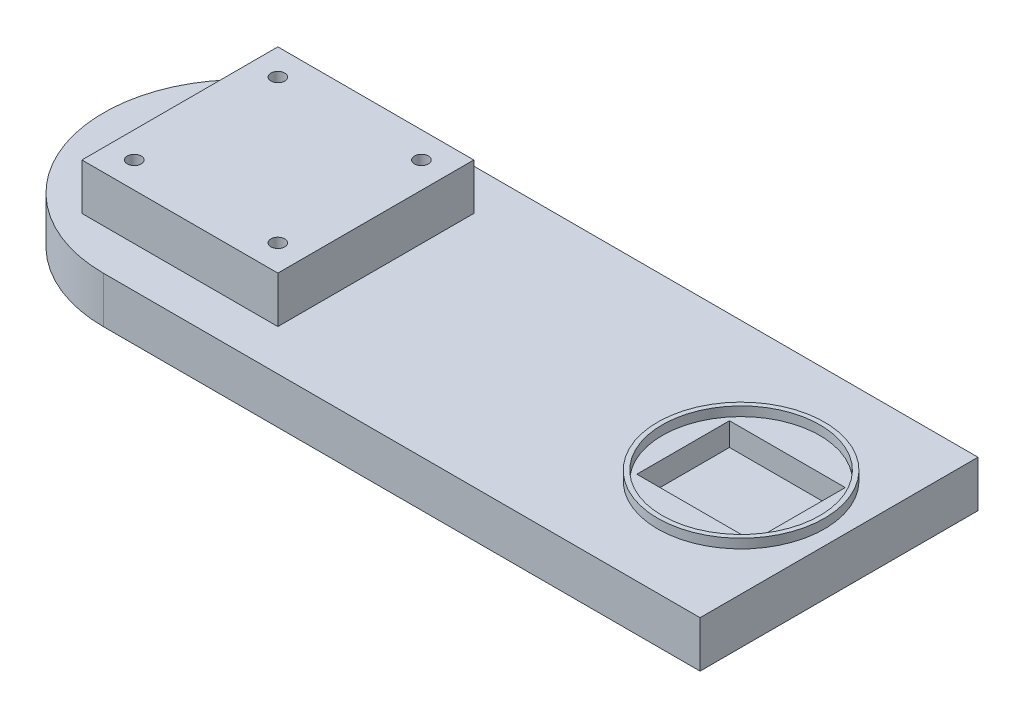
from build123d import *

# Parameters (mm, degrees)
BOSS_EXTRUDE1_DEPTH     = 10
SKETCH3_W               = 25
SKETCH3_H               = 20
CUT_EXTRUDE1_DEPTH      = 5
SKETCH5_R               = 18
SKETCH5_R_2             = 17
BOSS_EXTRUDE2_DEPTH     = 2
SKETCH2_3_W             = 42.3
SKETCH2_3_H             = 42.3
SKETCH2_3_R             = 1.5
BOSS_EXTRUDE3_DEPTH     = 20
CUT_EXTRUDE2_DEPTH      = 127.401433932
CUT_EXTRUDE2_DEPTH_BACK = 127.401433932
SKETCH2_4_R             = 1.5


with BuildPart() as part:
    # Sketch2 → Boss-Extrude1 (new body)
    with BuildSketch(Plane(origin=(0, 0, 0), x_dir=(1, 0, 0), z_dir=(0, 1, 0))):
        with BuildLine():
            ThreePointArc((-7.63782392, 30), (-37.63782392, 0), (-7.63782392, -30))
            Line((-7.63782392, -30), (121.15, -30))
            Line((121.15, -30), (121.15, 30))
            Line((121.15, 30), (-7.63782392, 30))
        make_face()
    extrude(amount=BOSS_EXTRUDE1_DEPTH)

    # Sketch3 → Cut-Extrude1 (cut)
    with BuildSketch(Plane(origin=(0, 10, 0), x_dir=(1, 0, 0), z_dir=(0, 1, 0))):
        with Locations((100, 0)):
            Rectangle(SKETCH3_W, SKETCH3_H)
    extrude(amount=-CUT_EXTRUDE1_DEPTH, mode=Mode.SUBTRACT)

    # Sketch5 → Boss-Extrude2 (add)
    with BuildSketch(Plane(origin=(0, 10, 0), x_dir=(1, 0, 0), z_dir=(0, 1, 0))):
        with Locations((100, 0)):
            Circle(SKETCH5_R)
        with Locations((100, 0)):
            Circle(SKETCH5_R_2, mode=Mode.SUBTRACT)
    extrude(amount=BOSS_EXTRUDE2_DEPTH)

    # Sketch2<3> → Boss-Extrude3 (add)
    with BuildSketch(Plane(origin=(0, 0, 0), x_dir=(1, 0, 0), z_dir=(0, 1, 0))):
        Rectangle(SKETCH2_3_W, SKETCH2_3_H)
        with Locations((-15.5, -15.5)):
            Circle(SKETCH2_3_R, mode=Mode.SUBTRACT)
        with Locations((15.5, -15.5)):
            Circle(SKETCH2_3_R, mode=Mode.SUBTRACT)
        with Locations((-15.5, 15.5)):
            Circle(SKETCH2_3_R, mode=Mode.SUBTRACT)
        with Locations((15.5, 15.5)):
            Circle(SKETCH2_3_R, mode=Mode.SUBTRACT)
    extrude(amount=BOSS_EXTRUDE3_DEPTH)

    # Sketch2<4> → Cut-Extrude2 (cut, two sides: drawn at the far end of the back side and taken through both)
    with BuildSketch(Plane(origin=(0, 0, 0), x_dir=(1, 0, 0), z_dir=(0, 1, 0)).offset(-CUT_EXTRUDE2_DEPTH_BACK)):
        with Locations((-15.5, 15.5)):
            Circle(SKETCH2_4_R)
        with Locations((15.5, 15.5)):
            Circle(SKETCH2_4_R)
        with Locations((15.5, -15.5)):
            Circle(SKETCH2_4_R)
        with Locations((-15.5, -15.5)):
            Circle(SKETCH2_4_R)
    extrude(amount=CUT_EXTRUDE2_DEPTH + CUT_EXTRUDE2_DEPTH_BACK, mode=Mode.SUBTRACT)


solid = part.part
